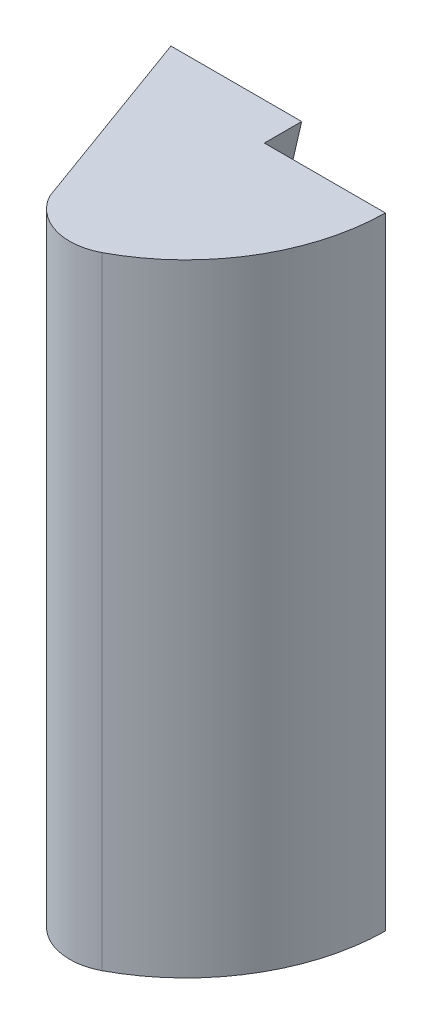
from build123d import *

# Parameters (mm, degrees)
BOSS_EXTRUDE1_DEPTH = 50
CUT_EXTRUDE1_START  = -50
CUT_EXTRUDE1_DEPTH  = 50
SKETCH3_R           = 1.6
CUT_EXTRUDE2_DEPTH  = 15
SKETCH6_R           = 1.6
CUT_EXTRUDE4_DEPTH  = 3
SKETCH7_W           = 1.666520658
SKETCH7_H           = 50
CUT_EXTRUDE5_DEPTH  = 3
CUT_EXTRUDE6_DEPTH  = 3


with BuildPart() as part:
    # Sketch1 → Boss-Extrude1 (new body)
    with BuildSketch(Plane(origin=(0, 0, 0), x_dir=(1, 0, 0), z_dir=(0, 1, 0))):
        with BuildLine():
            Line((13.159597133, 18.793852416), (-6.840402867, 18.793852416))
            Line((-6.840402867, 18.793852416), (0, 0))
            ThreePointArc((0, 0), (10.472132847, 6.671484404), (13.159597133, 18.793852416))
        make_face()
    extrude(amount=BOSS_EXTRUDE1_DEPTH)

    # Sketch5 → Cut-Extrude1 (cut)
    with BuildSketch(Plane(origin=(0, 50, 0), x_dir=(1, 0, 0), z_dir=(0, 1, 0)).offset(CUT_EXTRUDE1_START)):
        with BuildLine():
            ThreePointArc((4.765485224, 1.634621553), (1.372703273, 1.322660653), (-1.265925556, 3.478101879))
            Line((-1.265925556, 3.478101879), (0, 0))
            ThreePointArc((0, 0), (2.446582795, 0.63119464), (4.765485224, 1.634621553))
        make_face()
    extrude(amount=CUT_EXTRUDE1_DEPTH, mode=Mode.SUBTRACT)

    # Sketch3 → Cut-Extrude2 (cut)
    with BuildSketch(Plane(origin=(0, 0, -18.793852416), x_dir=(-1, 0, 0), z_dir=(0, 0, -1))):
        with Locations((-3.159597133, 20)):
            Circle(SKETCH3_R)
        with Locations((-3.159597133, 30)):
            Circle(SKETCH3_R)
    extrude(amount=-CUT_EXTRUDE2_DEPTH, mode=Mode.SUBTRACT)

    # Sketch6 → Cut-Extrude4 (cut)
    with BuildSketch(Plane(origin=(0, 0, -18.793852416), x_dir=(-1, 0, 0), z_dir=(0, 0, -1))):
        Polygon((0.945619298, 35), (-0.208721658, 35), (-3.671744525, 50), (-13.159597133, 50), (-13.159597133, 0), (-3.671744525, 0), (-0.208721658, 15), (0.945619298, 15), align=None)
        with Locations((-3.159597133, 20)):
            Circle(SKETCH6_R, mode=Mode.SUBTRACT)
        with Locations((-3.159597133, 30)):
            Circle(SKETCH6_R, mode=Mode.SUBTRACT)
    extrude(amount=-CUT_EXTRUDE4_DEPTH, mode=Mode.SUBTRACT)

    # Sketch7 → Cut-Extrude5 (cut)
    with BuildSketch(Plane(origin=(0, 0, -18.793852416), x_dir=(-1, 0, 0), z_dir=(0, 0, -1))):
        with Locations((-13.992857462, 25)):
            Rectangle(SKETCH7_W, SKETCH7_H)
    extrude(amount=-CUT_EXTRUDE5_DEPTH, mode=Mode.SUBTRACT)

    # Sketch6<5> → Cut-Extrude6 (cut)
    with BuildSketch(Plane(origin=(0, 0, -18.793852416), x_dir=(-1, 0, 0), z_dir=(0, 0, -1))):
        Polygon((0.945619298, 35), (0.945619298, 30), (0.945619298, 20), (0.945619298, 15), (1.945619298, 15), (1.945619298, 35), align=None)
    extrude(amount=-CUT_EXTRUDE6_DEPTH, mode=Mode.SUBTRACT)


solid = part.part
